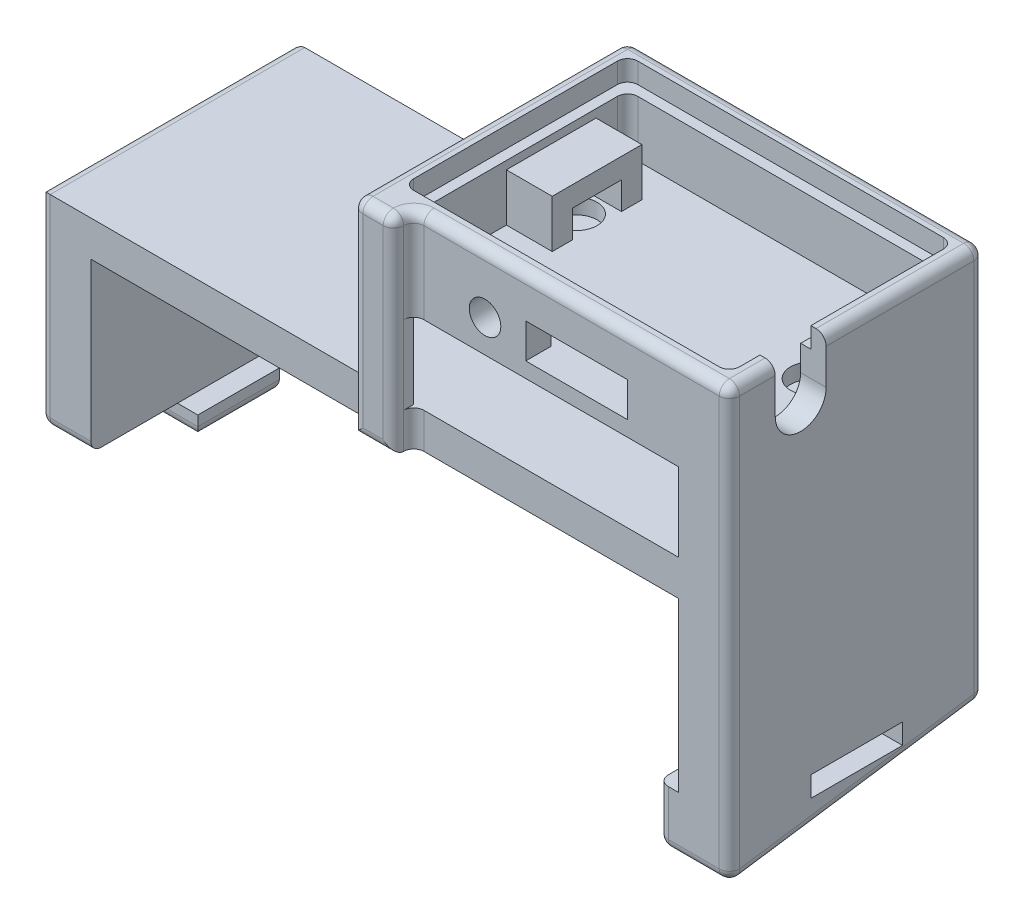
from build123d import *

# Parameters (mm, degrees)
BOSS_EXTRUDE1_DEPTH = 25
SKETCH2_W           = 57.7
SKETCH2_H           = 16.5
CUT_EXTRUDE1_DEPTH  = 52.159456604
SKETCH3_W           = 30
SKETCH3_H           = 20
CUT_EXTRUDE2_DEPTH  = 7.5
CUT_EXTRUDE3_REACH  = 58.541
SKETCH4_R           = 2
SKETCH5_R           = 2
CUT_EXTRUDE4_DEPTH  = 1.5
SKETCH6_W           = 7
SKETCH6_H           = 8
BOSS_EXTRUDE2_DEPTH = 2
SKETCH7_W           = 4
SKETCH7_H           = 20.2
BOSS_EXTRUDE3_DEPTH = 2
BOSS_EXTRUDE4_DEPTH = 7
SKETCH9_W           = 32
SKETCH9_H           = 22
CUT_EXTRUDE5_DEPTH  = 2
FILLET1_R           = 1
FILLET2_R           = 1
SKETCH10_R          = 1
BOSS_EXTRUDE5_DEPTH = 1.5
FILLET3_R           = 1
BOSS_EXTRUDE6_DEPTH = 2.7
CUT_EXTRUDE6_REACH  = 82.092
SKETCH13_W          = 4.5
SKETCH13_H          = 8.8
BOSS_EXTRUDE7_DEPTH = 2
SKETCH14_W          = 10
SKETCH14_H          = 3.4
CUT_EXTRUDE7_DEPTH  = 54.232805215
SKETCH15_R          = 1.55
CUT_EXTRUDE8_DEPTH  = 2.5


with BuildPart() as part:
    # Sketch1 → Boss-Extrude1 (new body)
    with BuildSketch(Plane.XY):
        Polygon((0, 0), (30, 0), (30, -7.7), (-32.7, -7.7), (-32.7, -27.7), (35, -27.7), (35, 9), (0, 9), align=None)
    extrude(amount=BOSS_EXTRUDE1_DEPTH)

    # Sketch2 → Cut-Extrude1 (cut, through all)
    with BuildSketch(Plane.XY.offset(25)):
        with Locations((1.15, -19.45)):
            Rectangle(SKETCH2_W, SKETCH2_H)
    extrude(amount=-CUT_EXTRUDE1_DEPTH, mode=Mode.SUBTRACT)

    # Sketch3 → Cut-Extrude2 (cut)
    with BuildSketch(Plane(origin=(0, 9, 0), x_dir=(1, 0, 0), z_dir=(0, 1, 0))):
        with Locations((17.5, -12.5)):
            Rectangle(SKETCH3_W, SKETCH3_H)
    extrude(amount=-CUT_EXTRUDE2_DEPTH, mode=Mode.SUBTRACT)

    # Cut-Extrude3: up to this face of the body (flat: up to its plane)
    cut_extrude3_end = Plane(part.part.faces().sort_by_distance((17.5, 1.5, 12.5))[0])
    # Sketch4 → Cut-Extrude3 (cut, up to the picked face)
    with BuildSketch(Plane.XZ.offset(27.7), mode=Mode.PRIVATE) as cut_extrude3_sk1:
        with Locations(Location((30.5, 12.5, 0), (0, 0, 255.522487814))):
            Circle(SKETCH4_R)
    cut_extrude3_tool1 = split(extrude(cut_extrude3_sk1.sketch, amount=-CUT_EXTRUDE3_REACH, mode=Mode.PRIVATE), bisect_by=cut_extrude3_end, keep=Keep.BOTH, mode=Mode.PRIVATE)
    add(cut_extrude3_tool1.solids().sort_by(Axis((30.5, -27.7, 12.5), (0, 1, 0)))[0], mode=Mode.SUBTRACT)

    # Sketch5 → Cut-Extrude4 (cut)
    with BuildSketch(Plane(origin=(0, 1.5, 0), x_dir=(1, 0, 0), z_dir=(0, 1, 0))):
        with Locations(Location((5, -10, 0), (0, 0, 180))):
            Circle(SKETCH5_R)
    extrude(amount=-CUT_EXTRUDE4_DEPTH, mode=Mode.SUBTRACT)

    # Sketch6 → Boss-Extrude2 (add)
    with BuildSketch(Plane.XZ.offset(27.7)):
        with Locations((31.5, 21)):
            Rectangle(SKETCH6_W, SKETCH6_H)
        with Locations((31.5, 4)):
            Rectangle(SKETCH6_W, SKETCH6_H)
        with Locations((-29.2, 12.5)):
            Rectangle(SKETCH6_W, SKETCH6_H)
    extrude(amount=BOSS_EXTRUDE2_DEPTH)

    # Sketch7 → Boss-Extrude3 (add)
    with BuildSketch(Plane.XY.offset(25)):
        with Locations((2, -1.1)):
            Rectangle(SKETCH7_W, SKETCH7_H)
    extrude(amount=BOSS_EXTRUDE3_DEPTH)

    # Sketch8 → Boss-Extrude4 (add)
    with BuildSketch(Plane(origin=(35, 0, 0), x_dir=(0, 0, -1), z_dir=(1, 0, 0))):
        Polygon((0, -29.7), (-25, -33.360714286), (-25, -29.7), align=None)
    extrude(amount=-BOSS_EXTRUDE4_DEPTH)

    # Sketch9 → Cut-Extrude5 (cut)
    with BuildSketch(Plane(origin=(0, 9, 0), x_dir=(1, 0, 0), z_dir=(0, 1, 0))):
        with Locations((17.5, -12.5)):
            Rectangle(SKETCH9_W, SKETCH9_H)
    extrude(amount=-CUT_EXTRUDE5_DEPTH, mode=Mode.SUBTRACT)

    # Fillet1
    fillet1_edges = [part.edges().sort_by_distance(p)[0] for p in [
        (33.5, 8, 1.5),
        (33.5, 8, 23.5),
        (1.5, 8, 23.5),
        (1.5, 8, 1.5),
        (2.5, 4.25, 22.5),
        (2.5, 4.25, 2.5),
        (32.5, 4.25, 2.5),
        (32.5, 4.25, 22.5),
    ]]
    fillet(fillet1_edges, radius=FILLET1_R)

    # Fillet2
    fillet2_edges = [part.edges().sort_by_distance(p)[0] for p in [
        (4, -9.45, 25),
        (4, 4.5, 25),
        (0, -9.45, 25),
    ]]
    fillet(fillet2_edges, radius=FILLET2_R)
    fillet2_2_edges = [part.edges().sort_by_distance(p)[0] for p in [
        (20, 9, 25),
        (0, 9, 13.5),
        (17.5, 9, 0),
        (35, 9, 12.5),
        (28, -30.530357143, 25),
        (28, -28.7, 0),
        (28, -31.530357143, 12.5),
        (35, -31.530357143, 12.5),
        (-30.2, -27.7, 0),
        (-30.2, -27.7, 25),
        (-29.2, -29.7, 8.5),
        (-29.2, -29.7, 16.5),
        (-32.7, -28.7, 8.5),
        (-32.7, -28.7, 16.5),
        (-32.7, -27.7, 20.75),
        (-32.7, -29.7, 12.5),
        (-32.7, -27.7, 4.25),
        (-32.7, -7.7, 12.5),
        (-32.7, -17.7, 0),
        (-32.7, -17.7, 25),
        (35, -10.35, 0),
        (35, -12.180357143, 25),
        (0, -1.1, 27),
        (0, 4.5, 0),
        (4, -1.1, 27),
        (2, -11.2, 27),
        (2, 9, 27),
        (31.5, -33.360714286, 25),
        (31.5, -29.7, 0),
        (-25.7, -29.7, 12.5),
        (4.292893219, 9, 25.292893219),
    ]]
    fillet(fillet2_2_edges, radius=FILLET2_R - 0.0001)  # a hair under: the kernel refuses the full size

    # Sketch10 → Boss-Extrude5 (add)
    with BuildSketch(Plane(origin=(-27.7, 0, 0), x_dir=(0, 0, -1), z_dir=(1, 0, 0))):
        with Locations(Location((-14, -13.55, 0), (0, 0, 180))):
            Circle(SKETCH10_R)
        with Locations(Location((-11, -13.55, 0), (0, 0, 180))):
            Circle(SKETCH10_R)
    extrude(amount=BOSS_EXTRUDE5_DEPTH)

    # Fillet3
    fillet3_edges = [part.edges().sort_by_distance(p)[0] for p in [
        (-26.2, -13.55, 13),
        (-26.2, -13.55, 10),
    ]]
    fillet(fillet3_edges, radius=FILLET3_R)

    # Sketch11 → Boss-Extrude6 (add)
    with BuildSketch(Plane(origin=(0, 1.5, 0), x_dir=(1, 0, 0), z_dir=(0, 1, 0))):
        Polygon((2.5, -5.6), (2.5, -14.4), (7, -14.4), (7, -12.4), (3, -12.4), (3, -7.6), (7, -7.6), (7, -5.6), align=None)
    extrude(amount=BOSS_EXTRUDE6_DEPTH)

    # Cut-Extrude6: up to this face of the body (flat: up to its plane)
    cut_extrude6_end = Plane(part.part.faces().sort_by_distance((32.5, 4.25, 12.5))[0])
    # Sketch12 → Cut-Extrude6 (cut, up to the picked face)
    with BuildSketch(Plane(origin=(35, 0, 0), x_dir=(0, 0, -1), z_dir=(1, 0, 0)), mode=Mode.PRIVATE) as cut_extrude6_sk1:
        with BuildLine():
            Line((-20.5, 9), (-20.5, 4.5))
            ThreePointArc((-20.5, 4.5), (-18, 2), (-15.5, 4.5))
            Line((-15.5, 4.5), (-15.5, 9))
            Line((-15.5, 9), (-20.5, 9))
        make_face()
    cut_extrude6_tool1 = split(extrude(cut_extrude6_sk1.sketch, amount=-CUT_EXTRUDE6_REACH, mode=Mode.PRIVATE), bisect_by=cut_extrude6_end, keep=Keep.BOTH, mode=Mode.PRIVATE)
    add(cut_extrude6_tool1.solids().sort_by(Axis((35, 5.744167, 18), (-1, 0, 0)))[0], mode=Mode.SUBTRACT)

    # Sketch13 → Boss-Extrude7 (add)
    with BuildSketch(Plane(origin=(0, 4.2, 0), x_dir=(1, 0, 0), z_dir=(0, 1, 0))):
        with Locations((4.75, -10)):
            Rectangle(SKETCH13_W, SKETCH13_H)
    extrude(amount=BOSS_EXTRUDE7_DEPTH)

    # Sketch14 → Cut-Extrude7 (cut, through all)
    with BuildSketch(Plane(origin=(0, 0, 22.5), x_dir=(-1, 0, 0), z_dir=(0, 0, -1))):
        with Locations((-20, 3.2)):
            Rectangle(SKETCH14_W, SKETCH14_H)
    extrude(amount=-CUT_EXTRUDE7_DEPTH, mode=Mode.SUBTRACT)

    # Sketch15 → Cut-Extrude8 (cut)
    with BuildSketch(Plane.XY.offset(25)):
        with Locations((11, 3.2)):
            Circle(SKETCH15_R)
    extrude(amount=-CUT_EXTRUDE8_DEPTH, mode=Mode.SUBTRACT)


solid = part.part
